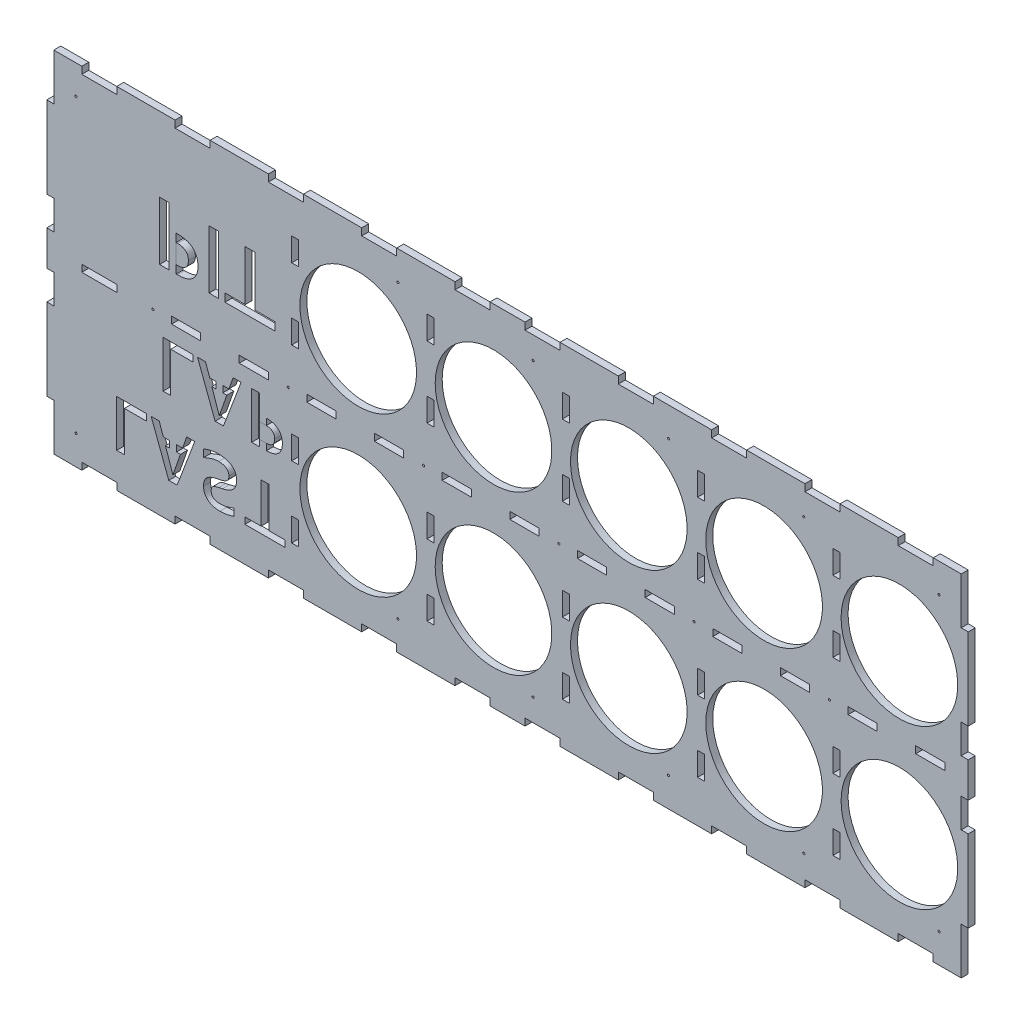
from build123d import *

# Parameters (mm, degrees)
SKETCH1_W           = 790
SKETCH1_H           = 300
BOSS_EXTRUDE1_DEPTH = 6
SKETCH2_R           = 50
SKETCH2_W           = 8.227848101
SKETCH2_H           = 50
CUT_EXTRUDE1_DEPTH  = 10
SKETCH3_W           = 6
SKETCH3_H           = 12.668314779
SKETCH3_H_2         = 22.429208267
SKETCH3_H_3         = 49.496892202
SKETCH3_H_4         = 32.552578478
BOSS_EXTRUDE2_DEPTH = 6
SKETCH4_W           = 6
SKETCH4_H           = 40
SKETCH4_H_2         = 25
SKETCH4_W_2         = 30
SKETCH4_H_3         = 6
CUT_EXTRUDE2_DEPTH  = 6
SKETCH5_W           = 6
SKETCH5_H           = 20
SKETCH5_W_2         = 25
SKETCH5_H_2         = 6
SKETCH5_W_3         = 30
CUT_EXTRUDE3_DEPTH  = 6
SKETCH6_R           = 0.9
CUT_EXTRUDE4_DEPTH  = 10


with BuildPart() as part:
    # Sketch1 → Boss-Extrude1 (new body)
    with BuildSketch(Plane.XY):
        Rectangle(SKETCH1_W, SKETCH1_H)
    extrude(amount=BOSS_EXTRUDE1_DEPTH)

    # Sketch2 → Cut-Extrude1 (cut)
    # profile 1 of 20: a face of its own
    with BuildSketch(Plane(origin=(0, 0, 0), x_dir=(-1, 0, 0), z_dir=(0, 0, -1))):
        with Locations((-336, -70)):
            Circle(SKETCH2_R)
    # profile 2 of 20: a face of its own
    with BuildSketch(Plane(origin=(0, 0, 0), x_dir=(-1, 0, 0), z_dir=(0, 0, -1))):
        with Locations((-220, -70)):
            Circle(SKETCH2_R)
    # profile 3 of 20: a face of its own
    with BuildSketch(Plane(origin=(0, 0, 0), x_dir=(-1, 0, 0), z_dir=(0, 0, -1))):
        with Locations((-220, 66)):
            Circle(SKETCH2_R)
    # profile 4 of 20: a face of its own
    with BuildSketch(Plane(origin=(0, 0, 0), x_dir=(-1, 0, 0), z_dir=(0, 0, -1))):
        with Locations((-336, 66)):
            Circle(SKETCH2_R)
    # profile 5 of 20: a face of its own
    with BuildSketch(Plane(origin=(0, 0, 0), x_dir=(-1, 0, 0), z_dir=(0, 0, -1))):
        with Locations((-104, -70)):
            Circle(SKETCH2_R)
    # profile 6 of 20: a face of its own
    with BuildSketch(Plane(origin=(0, 0, 0), x_dir=(-1, 0, 0), z_dir=(0, 0, -1))):
        with Locations((-104, 66)):
            Circle(SKETCH2_R)
    # profile 7 of 20: a face of its own
    with BuildSketch(Plane(origin=(0, 0, 0), x_dir=(-1, 0, 0), z_dir=(0, 0, -1))):
        with Locations((12, -70)):
            Circle(SKETCH2_R)
    # profile 8 of 20: a face of its own
    with BuildSketch(Plane(origin=(0, 0, 0), x_dir=(-1, 0, 0), z_dir=(0, 0, -1))):
        with Locations((12, 66)):
            Circle(SKETCH2_R)
    # profile 9 of 20: a face of its own
    with BuildSketch(Plane(origin=(0, 0, 0), x_dir=(-1, 0, 0), z_dir=(0, 0, -1))):
        with Locations((128, -70)):
            Circle(SKETCH2_R)
    # profile 10 of 20: a face of its own
    with BuildSketch(Plane(origin=(0, 0, 0), x_dir=(-1, 0, 0), z_dir=(0, 0, -1))):
        with Locations((128, 66)):
            Circle(SKETCH2_R)
    # profile 11 of 20: a face of its own
    with BuildSketch(Plane(origin=(0, 0, 0), x_dir=(-1, 0, 0), z_dir=(0, 0, -1))):
        Polygon((225.14556962, -120.218798151), (190.778481013, -120.218798151), (190.778481013, -114.649177898), (204.670886076, -114.649177898), (204.670886076, -80.218798151), (211.253164557, -80.218798151), (211.253164557, -114.649177898), (225.14556962, -114.649177898), align=None)
    # profile 12 of 20: a face of its own
    with BuildSketch(Plane(origin=(0, 0, 0), x_dir=(-1, 0, 0), z_dir=(0, 0, -1))):
        with BuildLine():
            Line((234.417721519, -118.952975366), (234.417721519, -112.971962708))
            add(Edge.make_bspline(
                [(234.417721519, -112.971962708), (235.081521479, -113.190583584), (236.340343747, -113.605173586), (238.137874243, -114.156998824), (239.734320913, -114.627998701), (241.159542182, -115.010208817), (242.471389001, -115.311664329), (243.728141686, -115.500857847), (244.949935558, -115.640852865), (245.754362835, -115.654914658), (246.150316456, -115.661836126)],
                knots=[0, 0, 0, 0, 1.387514266, 2.631265383, 3.733085333, 4.691935806, 5.560824757, 6.403543179, 7.214195147, 8, 8, 8, 8], degree=3))
            add(Edge.make_bspline(
                [(246.150316456, -115.661836126), (246.461695835, -115.6579689), (247.064219989, -115.650485755), (247.94032113, -115.573265886), (248.761822925, -115.472309692), (249.524023779, -115.300457608), (250.232028032, -115.098510987), (250.882662659, -114.847517322), (251.47460663, -114.542035129), (252.014125552, -114.197569058), (252.493419755, -113.799592872), (252.905650943, -113.35369311), (253.261896856, -112.865223712), (253.545419316, -112.322996421), (253.768014199, -111.733115497), (253.924621023, -111.095721916), (254.021249683, -110.411631251), (254.032291606, -109.939594818), (254.037974684, -109.696646252)],
                knots=[0, 0, 0, 0, 1.326535467, 2.56686767, 3.746182198, 4.850559987, 5.892565486, 6.88178199, 7.816648485, 8.726872872, 9.604603928, 10.463425553, 11.308684229, 12.173368185, 13.062535959, 13.989261226, 14.965109325, 16, 16, 16, 16], degree=3))
            add(Edge.make_bspline(
                [(254.037974684, -109.696646252), (254.032102073, -109.49088797), (254.020712168, -109.09182066), (253.970807997, -108.513865466), (253.865893234, -107.982280913), (253.726379485, -107.492267122), (253.534124724, -107.051889962), (253.312976856, -106.64678864), (253.042924792, -106.290582627), (252.726324164, -105.973678737), (252.347210321, -105.688533896), (251.895102966, -105.42632819), (251.369535125, -105.160283829), (250.761008706, -104.921987949), (250.07540711, -104.68921146), (249.309767057, -104.482642745), (248.466427515, -104.273254229), (247.875485876, -104.151263514), (247.566455696, -104.087469037)],
                knots=[0, 0, 0, 0, 1.028575137, 1.994917085, 2.894249351, 3.732318196, 4.53514972, 5.290280212, 6.033474337, 6.760249435, 7.52190509, 8.396472701, 9.36881544, 10.462595607, 11.65852342, 12.985296272, 14.423474718, 16, 16, 16, 16], degree=3))
            Line((247.566455696, -104.087469037), (244.433544304, -103.454557645))
            add(Edge.make_bspline(
                [(244.433544304, -103.454557645), (243.925816166, -103.346984679), (242.940982709, -103.138326842), (241.526290735, -102.737748059), (240.21371506, -102.292434646), (239.004836366, -101.785886862), (237.903556244, -101.22285903), (236.896666827, -100.616298177), (236.000207188, -99.940774226), (235.202088685, -99.211975189), (234.51047862, -98.419744872), (233.901741406, -97.578794847), (233.39739387, -96.674012484), (232.981959471, -95.714402726), (232.658522175, -94.702127347), (232.428205215, -93.631949556), (232.293943584, -92.505992897), (232.275326111, -91.735510258), (232.265822785, -91.342215872)],
                knots=[0, 0, 0, 0, 1.316920217, 2.554412477, 3.729152209, 4.833016039, 5.877706238, 6.866052438, 7.812465869, 8.721947532, 9.604074217, 10.47706315, 11.352102319, 12.227448608, 13.127049825, 14.044696133, 15.001911276, 16, 16, 16, 16], degree=3))
            add(Edge.make_bspline(
                [(232.265822785, -91.342215872), (232.276917789, -90.869406848), (232.298521213, -89.948785888), (232.49703091, -88.611447952), (232.795907487, -87.352295837), (233.247641259, -86.182290659), (233.807669404, -85.089270218), (234.502378176, -84.084510481), (235.326570026, -83.168196934), (236.272821955, -82.336315044), (237.335300613, -81.59118059), (238.516193937, -80.947045812), (239.81507679, -80.411036592), (241.22470572, -79.972673693), (242.744694951, -79.62137266), (244.380034668, -79.384115578), (246.128850245, -79.228943442), (247.334032507, -79.21388677), (247.954113924, -79.206139923)],
                knots=[0, 0, 0, 0, 1.007234792, 1.961217769, 2.876056137, 3.760332692, 4.627742002, 5.488477075, 6.356323441, 7.24844489, 8.16857014, 9.11698855, 10.10981412, 11.158773728, 12.260582194, 13.431628951, 14.678540823, 16, 16, 16, 16], degree=3))
            add(Edge.make_bspline(
                [(247.954113924, -79.206139923), (248.426377333, -79.214156725), (249.385516406, -79.230438375), (250.843708555, -79.35277366), (252.340201936, -79.560857773), (253.88086348, -79.850161301), (255.480716832, -80.211009804), (257.137248625, -80.686177914), (258.867286213, -81.233481279), (260.026229167, -81.67150258), (260.620253165, -81.896013341)],
                knots=[0, 0, 0, 0, 0.870421616, 1.767774863, 2.695117159, 3.65420996, 4.656488843, 5.716777356, 6.829718893, 8, 8, 8, 8], degree=3))
            Line((260.620253165, -81.896013341), (260.438291139, -88.264684227))
            add(Edge.make_bspline(
                [(260.438291139, -88.264684227), (259.761580895, -87.977436052), (258.471365844, -87.429768978), (256.61150583, -86.685124878), (254.912897375, -86.08544162), (253.360687871, -85.597556673), (251.902945606, -85.217564126), (250.478965968, -84.970558352), (249.073787643, -84.799754328), (248.13920631, -84.783697527), (247.67721519, -84.775760176)],
                knots=[0, 0, 0, 0, 1.323958492, 2.524257894, 3.607270171, 4.567153054, 5.454098878, 6.317697212, 7.16838811, 8, 8, 8, 8], degree=3))
            add(Edge.make_bspline(
                [(247.67721519, -84.775760176), (247.328983482, -84.779573155), (246.652647711, -84.786978724), (245.669252172, -84.865353391), (244.754058304, -85.003333944), (243.896411262, -85.169551284), (243.10772081, -85.411370613), (242.375190343, -85.689556958), (241.713954111, -86.036855744), (241.110692209, -86.419911351), (240.575786894, -86.857376711), (240.115548368, -87.342629547), (239.720829526, -87.869040758), (239.405220608, -88.446246622), (239.14723132, -89.06240559), (238.980029734, -89.726849459), (238.8600757, -90.428063875), (238.852164409, -90.911808467), (238.848101266, -91.160253847)],
                knots=[0, 0, 0, 0, 1.355236094, 2.632140116, 3.835515897, 4.956769147, 6.028392437, 7.042429441, 8.001907206, 8.930073714, 9.81981653, 10.683786847, 11.527521437, 12.372940068, 13.2383116, 14.119666881, 15.034283621, 16, 16, 16, 16], degree=3))
            add(Edge.make_bspline(
                [(238.848101266, -91.160253847), (238.8513918, -91.376858387), (238.857835865, -91.801048892), (238.945090852, -92.41590758), (239.052675357, -93.000671556), (239.245088289, -93.538759019), (239.459841429, -94.050691651), (239.740610951, -94.518751535), (240.069029975, -94.94906286), (240.443502268, -95.352279702), (240.889246542, -95.717145053), (241.393809026, -96.067500283), (241.980824177, -96.382708676), (242.6338198, -96.676161546), (243.34975085, -96.970128523), (244.144523194, -97.213810492), (245.005571271, -97.455901249), (245.608911498, -97.587473672), (245.920886076, -97.655507012)],
                knots=[0, 0, 0, 0, 0.97844014, 1.916141821, 2.804796213, 3.660769132, 4.49375928, 5.311764199, 6.120240336, 6.938505946, 7.793481616, 8.71958745, 9.712166798, 10.80067234, 11.956522289, 13.20850853, 14.556578305, 16, 16, 16, 16], degree=3))
            Line((245.920886076, -97.655507012), (249.125, -98.288418404))
            add(Edge.make_bspline(
                [(249.125, -98.288418404), (249.608882572, -98.388389364), (250.550869909, -98.583005545), (251.898803607, -98.95701386), (253.147185942, -99.369958994), (254.299768004, -99.813573295), (255.343642252, -100.323183279), (256.292340346, -100.866260489), (257.135791822, -101.46095813), (257.880997713, -102.105228273), (258.527512021, -102.811173043), (259.095141933, -103.570195829), (259.563124357, -104.405343202), (259.951772604, -105.300752177), (260.252853259, -106.263706956), (260.461978803, -107.292381214), (260.603451813, -108.384705511), (260.614561249, -109.137104384), (260.620253165, -109.522595619)],
                knots=[0, 0, 0, 0, 1.332781836, 2.594562577, 3.771290481, 4.879812294, 5.923558003, 6.902274905, 7.826154199, 8.703636118, 9.554612488, 10.404159945, 11.254898329, 12.131225666, 13.033594531, 13.971315179, 14.960604212, 16, 16, 16, 16], degree=3))
            add(Edge.make_bspline(
                [(260.620253165, -109.522595619), (260.611809821, -109.966371661), (260.595348978, -110.831541734), (260.403089062, -112.092080741), (260.115053832, -113.280426331), (259.711925305, -114.401629915), (259.176289863, -115.443611443), (258.52561769, -116.412844524), (257.755213496, -117.307053698), (256.878837385, -118.128519385), (255.898933626, -118.861916285), (254.829137032, -119.498136778), (253.677510931, -120.039056683), (252.43536542, -120.471641813), (251.111704286, -120.810625986), (249.704393151, -121.053153139), (248.216021252, -121.207985007), (247.195016899, -121.22351047), (246.672468354, -121.231456379)],
                knots=[0, 0, 0, 0, 1.034391986, 2.016614024, 2.967035657, 3.88364751, 4.788813341, 5.693100755, 6.600563169, 7.536297846, 8.489820244, 9.449888662, 10.435111384, 11.452683468, 12.513536151, 13.618971183, 14.781392911, 16, 16, 16, 16], degree=3))
            add(Edge.make_bspline(
                [(246.672468354, -121.231456379), (246.202844357, -121.226106377), (245.254572066, -121.215303569), (243.827317671, -121.103028109), (242.379950191, -120.94973222), (240.906821419, -120.71679035), (239.38615414, -120.406041911), (237.798715948, -120.00478156), (236.130173241, -119.52449572), (234.999206291, -119.147042374), (234.417721519, -118.952975366)],
                knots=[0, 0, 0, 0, 0.899764631, 1.816819142, 2.742107722, 3.68843727, 4.673587613, 5.715410157, 6.82538194, 8, 8, 8, 8], degree=3))
        make_face()
    # profile 13 of 20: a face of its own
    with BuildSketch(Plane(origin=(0, 0, 0), x_dir=(-1, 0, 0), z_dir=(0, 0, -1))):
        Polygon((290.422468354, -120.218798151), (283.294303797, -120.218798151), (268.143987342, -80.218798151), (275.026898734, -80.218798151), (278.594936709, -90.345380429), (295.058544304, -90.345380429), (298.626582278, -80.218798151), (305.517405063, -80.218798151), align=None)
        Polygon((286.85443038, -114.396013341), (293.254746835, -95.915000683), (280.414556962, -95.915000683), align=None, mode=Mode.SUBTRACT)
    # profile 14 of 20: a face of its own
    with BuildSketch(Plane(origin=(0, 0, 0), x_dir=(-1, 0, 0), z_dir=(0, 0, -1))):
        Polygon((335.050632911, -120.218798151), (328.46835443, -120.218798151), (328.46835443, -85.788418404), (309.393987342, -85.788418404), (309.393987342, -80.218798151), (335.050632911, -80.218798151), align=None)
    # profile 15 of 20: a face of its own
    with BuildSketch(Plane(origin=(0, 0, 0), x_dir=(-1, 0, 0), z_dir=(0, 0, -1))):
        with BuildLine():
            Line((219.35443038, -56.421329796), (207.115506329, -56.421329796))
            add(Edge.make_bspline(
                [(207.115506329, -56.421329796), (206.550781715, -56.41354521), (205.453482986, -56.398419224), (203.862414328, -56.24386862), (202.374879406, -56.003995204), (200.994191689, -55.658753791), (199.722756615, -55.207433905), (198.560089958, -54.661700014), (197.503989801, -54.017608021), (196.560706656, -53.271379136), (195.723116422, -52.436037454), (194.997476214, -51.51170493), (194.389392091, -50.50242951), (193.884870623, -49.415909793), (193.49776419, -48.244872965), (193.224505682, -46.990711948), (193.054935044, -45.655921745), (193.03535519, -44.739359311), (193.025316456, -44.269431062)],
                knots=[0, 0, 0, 0, 1.277438102, 2.482150011, 3.613205912, 4.684143857, 5.697637066, 6.661209294, 7.585322811, 8.490202945, 9.376256063, 10.255997937, 11.142211775, 12.036564167, 12.961159168, 13.926798438, 14.937054428, 16, 16, 16, 16], degree=3))
            add(Edge.make_bspline(
                [(193.025316456, -44.269431062), (193.035242784, -43.796845947), (193.054550774, -42.877606908), (193.224347662, -41.542952452), (193.496163049, -40.289729701), (193.897061004, -39.122951124), (194.392600357, -38.031508356), (195.007479361, -37.02344956), (195.739408856, -36.105469734), (196.576746582, -35.264623772), (197.52839319, -34.521565856), (198.59183589, -33.877020692), (199.762513306, -33.331478117), (201.041771995, -32.880129002), (202.430335068, -32.534898348), (203.925742489, -32.295021405), (205.527329564, -32.140200196), (206.632531597, -32.12524524), (207.202531646, -32.117532328)],
                knots=[0, 0, 0, 0, 1.065153118, 2.071860278, 3.02830301, 3.951547624, 4.848157081, 5.726178742, 6.606512709, 7.489453297, 8.395828193, 9.321768641, 10.287335273, 11.30287145, 12.37581297, 13.508762086, 14.715161852, 16, 16, 16, 16], degree=3))
            Line((207.202531646, -32.117532328), (212.772151899, -32.117532328))
            Line((212.772151899, -32.117532328), (212.772151899, -16.421329796))
            Line((212.772151899, -16.421329796), (219.35443038, -16.421329796))
            Line((219.35443038, -16.421329796), (219.35443038, -56.421329796))
        make_face()
        with BuildLine():
            Line((212.772151899, -50.851709543), (212.772151899, -37.687152581))
            Line((212.772151899, -37.687152581), (207.004746835, -37.687152581))
            add(Edge.make_bspline(
                [(207.004746835, -37.687152581), (206.714468816, -37.690876161), (206.148582825, -37.698135139), (205.326140663, -37.77839103), (204.55545597, -37.909758489), (203.839694117, -38.102981656), (203.172101028, -38.33601266), (202.558920657, -38.630065504), (202.000569904, -38.979239264), (201.500213847, -39.384962948), (201.057196399, -39.838318871), (200.663031628, -40.329962488), (200.339204629, -40.875196593), (200.066719412, -41.462431524), (199.864213148, -42.101375456), (199.71211777, -42.783956692), (199.627124057, -43.513079616), (199.614205123, -44.013422402), (199.607594937, -44.269431062)],
                knots=[0, 0, 0, 0, 1.234500831, 2.406612556, 3.511399, 4.55635263, 5.557008239, 6.515391404, 7.442943421, 8.352270097, 9.248702812, 10.13525329, 11.026052437, 11.939659621, 12.883353545, 13.871415421, 14.9108745, 16, 16, 16, 16], degree=3))
            add(Edge.make_bspline(
                [(199.607594937, -44.269431062), (199.614059295, -44.525458997), (199.626627112, -45.023221085), (199.712981954, -45.749490764), (199.86395362, -46.429709196), (200.067435695, -47.068071022), (200.337271624, -47.658600867), (200.6747377, -48.19927068), (201.061890203, -48.700304278), (201.5094488, -49.155615985), (202.013028704, -49.558924463), (202.579056209, -49.898241232), (203.183389997, -50.203671885), (203.850180747, -50.435909671), (204.562404325, -50.632276801), (205.332962377, -50.746416177), (206.150478596, -50.844770926), (206.714311613, -50.849350543), (207.004746835, -50.851709543)],
                knots=[0, 0, 0, 0, 1.089888154, 2.118928947, 3.107682707, 4.052037448, 4.96628438, 5.863555534, 6.75956164, 7.656622077, 8.575338335, 9.497614461, 10.461584131, 11.452375249, 12.498060601, 13.601738083, 14.764634717, 16, 16, 16, 16], degree=3))
            Line((207.004746835, -50.851709543), (212.772151899, -50.851709543))
        make_face(mode=Mode.SUBTRACT)
    # profile 16 of 20: a face of its own
    with BuildSketch(Plane(origin=(0, 0, 0), x_dir=(-1, 0, 0), z_dir=(0, 0, -1))):
        Polygon((250.675632911, -56.421329796), (243.547468354, -56.421329796), (228.397151899, -16.421329796), (235.280063291, -16.421329796), (238.848101266, -26.547912075), (255.311708861, -26.547912075), (258.879746835, -16.421329796), (265.77056962, -16.421329796), align=None)
        Polygon((247.107594937, -50.598544986), (253.507911392, -32.117532328), (240.667721519, -32.117532328), align=None, mode=Mode.SUBTRACT)
    # profile 17 of 20: a face of its own
    with BuildSketch(Plane(origin=(0, 0, 0), x_dir=(-1, 0, 0), z_dir=(0, 0, -1))):
        Polygon((295.303797468, -56.421329796), (288.721518987, -56.421329796), (288.721518987, -21.99095005), (269.647151899, -21.99095005), (269.647151899, -16.421329796), (295.303797468, -16.421329796), align=None)
    # profile 18 of 20: a face of its own
    with BuildSketch(Plane(origin=(0, 0, 0), x_dir=(-1, 0, 0), z_dir=(0, 0, -1))):
        with BuildLine():
            Line((298.275758659, 36.137930577), (282.977103596, 36.137930577))
            add(Edge.make_bspline(
                [(282.977103596, 36.137930577), (282.271197829, 36.14766131), (280.899574418, 36.166568793), (278.910738595, 36.359757047), (277.051319943, 36.659598818), (275.325460296, 37.091150584), (273.736166453, 37.655300442), (272.282833133, 38.337467806), (270.962707936, 39.142582796), (269.783604005, 40.075368903), (268.736616213, 41.119546004), (267.829565952, 42.27496166), (267.069460799, 43.536555935), (266.438808964, 44.894705582), (265.954925922, 46.358501616), (265.613352787, 47.926202887), (265.40138949, 49.594690641), (265.376914672, 50.740393683), (265.364366254, 51.327803995)],
                knots=[0, 0, 0, 0, 1.277438102, 2.482150011, 3.613205912, 4.684143857, 5.697637066, 6.661209294, 7.585322811, 8.490202945, 9.376256063, 10.255997937, 11.142211775, 12.036564167, 12.961159168, 13.926798438, 14.937054428, 16, 16, 16, 16], degree=3))
            add(Edge.make_bspline(
                [(265.364366254, 51.327803995), (265.376774165, 51.918535389), (265.400909152, 53.067584187), (265.613155262, 54.735902257), (265.952924496, 56.302430696), (266.45404694, 57.760903918), (267.073471131, 59.125207377), (267.842069886, 60.385280872), (268.756981755, 61.532755655), (269.803653913, 62.583813108), (270.993212173, 63.512635503), (272.322515547, 64.318316957), (273.785862318, 65.000245177), (275.384935678, 65.56443157), (277.120639519, 65.995969888), (278.989898796, 66.295816066), (280.991882639, 66.489342578), (282.37338518, 66.508036273), (283.085885242, 66.517677412)],
                knots=[0, 0, 0, 0, 1.065153118, 2.071860278, 3.02830301, 3.951547624, 4.848157081, 5.726178742, 6.606512709, 7.489453297, 8.395828193, 9.321768641, 10.287335273, 11.30287145, 12.37581297, 13.508762086, 14.715161852, 16, 16, 16, 16], degree=3))
            Line((283.085885242, 66.517677412), (290.047910558, 66.517677412))
            Line((290.047910558, 66.517677412), (290.047910558, 86.137930577))
            Line((290.047910558, 86.137930577), (298.275758659, 86.137930577))
            Line((298.275758659, 86.137930577), (298.275758659, 36.137930577))
        make_face()
        with BuildLine():
            Line((290.047910558, 43.099955893), (290.047910558, 59.555652096))
            Line((290.047910558, 59.555652096), (282.838654229, 59.555652096))
            add(Edge.make_bspline(
                [(282.838654229, 59.555652096), (282.475806705, 59.550997621), (281.768449216, 59.541923898), (280.740396513, 59.441604034), (279.777040648, 59.277394712), (278.882338331, 59.035865753), (278.047846969, 58.744576997), (277.281371506, 58.377010942), (276.583433065, 57.940543742), (275.957987993, 57.433389138), (275.404216184, 56.866694234), (274.91151022, 56.252139713), (274.506726471, 55.570597081), (274.16611995, 54.836553417), (273.91298712, 54.037873502), (273.722867898, 53.184646957), (273.616625756, 52.273243302), (273.600477089, 51.64781482), (273.592214356, 51.327803995)],
                knots=[0, 0, 0, 0, 1.234500831, 2.406612556, 3.511399, 4.55635263, 5.557008239, 6.515391404, 7.442943421, 8.352270097, 9.248702812, 10.13525329, 11.026052437, 11.939659621, 12.883353545, 13.871415421, 14.9108745, 16, 16, 16, 16], degree=3))
            add(Edge.make_bspline(
                [(273.592214356, 51.327803995), (273.600294803, 51.007769076), (273.616004575, 50.385566466), (273.723948127, 49.477729368), (273.91266271, 48.627456327), (274.167015303, 47.829504044), (274.504310215, 47.091341739), (274.92614281, 46.415504472), (275.410083439, 45.789212474), (275.969531684, 45.220072842), (276.599006565, 44.715937244), (277.306540946, 44.291791282), (278.061958181, 43.910002967), (278.895446618, 43.619705734), (279.78572609, 43.374246821), (280.748923656, 43.231572602), (281.770818929, 43.108629165), (282.4756102, 43.102904644), (282.838654229, 43.099955893)],
                knots=[0, 0, 0, 0, 1.089888154, 2.118928947, 3.107682707, 4.052037448, 4.96628438, 5.863555534, 6.75956164, 7.656622077, 8.575338335, 9.497614461, 10.461584131, 11.452375249, 12.498060601, 13.601738083, 14.764634717, 16, 16, 16, 16], degree=3))
            Line((282.838654229, 43.099955893), (290.047910558, 43.099955893))
        make_face(mode=Mode.SUBTRACT)
    # profile 19 of 20: a face of its own
    with BuildSketch(Plane(origin=(0, 0, 0), x_dir=(-1, 0, 0), z_dir=(0, 0, -1))):
        with Locations((251.756771318, 61.137930577)):
            Rectangle(SKETCH2_W, SKETCH2_H)
    # profile 20 of 20: a face of its own
    with BuildSketch(Plane(origin=(0, 0, 0), x_dir=(-1, 0, 0), z_dir=(0, 0, -1))):
        Polygon((242.22354347, 36.137930577), (199.26468271, 36.137930577), (199.26468271, 43.099955893), (216.630189039, 43.099955893), (216.630189039, 86.137930577), (224.858037141, 86.137930577), (224.858037141, 43.099955893), (242.22354347, 43.099955893), align=None)
    extrude(amount=-CUT_EXTRUDE1_DEPTH, mode=Mode.SUBTRACT)


with BuildPart() as cut_extrude1_piece_1:
    # of the separate pieces the step leaves, piece 1, a body of its own (cut_extrude1_pieces)
    add(part.part.solids().sort_by_distance((395, 150, 0))[0])



with BuildPart() as cut_extrude1_piece_2:
    # of the separate pieces the step leaves, piece 2, a body of its own (cut_extrude1_pieces)
    add(part.part.solids().sort_by_distance((-290.047910558, 43.099955893, 0))[0])


with BuildPart() as cut_extrude1_piece_3:
    # of the separate pieces the step leaves, piece 3, a body of its own (cut_extrude1_pieces)
    add(part.part.solids().sort_by_distance((-212.772151899, -50.851709543, 0))[0])


with BuildPart() as cut_extrude1_piece_4:
    # of the separate pieces the step leaves, piece 4, a body of its own (cut_extrude1_pieces)
    add(part.part.solids().sort_by_distance((-286.85443038, -114.396013341, 0))[0])


with BuildPart() as cut_extrude1_piece_5:
    # of the separate pieces the step leaves, piece 5, a body of its own (cut_extrude1_pieces)
    add(part.part.solids().sort_by_distance((-247.107594937, -50.598544986, 0))[0])


with BuildPart() as cut_extrude1_piece_1_1:
    add(cut_extrude1_piece_1.part)

    add(cut_extrude1_piece_4.part)  # Boss-Extrude2 merges Cut-Extrude1 piece 4

    add(cut_extrude1_piece_5.part)  # Boss-Extrude2 merges Cut-Extrude1 piece 5
    # Sketch3 → Boss-Extrude2 (add)
    with BuildSketch(Plane(origin=(0, 0, 0), x_dir=(-1, 0, 0), z_dir=(0, 0, -1))):
        with Locations((286.858386076, -93.696525154)):
            Rectangle(SKETCH3_W, SKETCH3_H)
        with Locations((247.111550633, -25.112303189)):
            Rectangle(SKETCH3_W, SKETCH3_H_2)
        with Locations((287.047910558, 56.796967493)):
            Rectangle(SKETCH3_W, SKETCH3_H_3)
        with Locations((209.772151899, -43.534195964)):
            Rectangle(SKETCH3_W, SKETCH3_H_4)
    extrude(amount=-BOSS_EXTRUDE2_DEPTH)

    # Sketch4 → Cut-Extrude2 (cut)
    with BuildSketch(Plane(origin=(0, 0, 0), x_dir=(-1, 0, 0), z_dir=(0, 0, -1))):
        with Locations((-392, -130)):
            Rectangle(SKETCH4_W, SKETCH4_H)
        with Locations((-392, -27.5)):
            Rectangle(SKETCH4_W, SKETCH4_H_2)
        with Locations((-30, 147)):
            Rectangle(SKETCH4_W_2, SKETCH4_H_3)
        with Locations((-392, 27.5)):
            Rectangle(SKETCH4_W, SKETCH4_H_2)
        with Locations((-392, 130)):
            Rectangle(SKETCH4_W, SKETCH4_H)
        with Locations((392, 130)):
            Rectangle(SKETCH4_W, SKETCH4_H)
        with Locations((392, 27.5)):
            Rectangle(SKETCH4_W, SKETCH4_H_2)
        with Locations((392, -27.5)):
            Rectangle(SKETCH4_W, SKETCH4_H_2)
        with Locations((392, -130)):
            Rectangle(SKETCH4_W, SKETCH4_H)
        with Locations((-110, 147)):
            Rectangle(SKETCH4_W_2, SKETCH4_H_3)
        with Locations((-190, 147)):
            Rectangle(SKETCH4_W_2, SKETCH4_H_3)
        with Locations((-270, 147)):
            Rectangle(SKETCH4_W_2, SKETCH4_H_3)
        with Locations((-350, 147)):
            Rectangle(SKETCH4_W_2, SKETCH4_H_3)
        with Locations((350, 147)):
            Rectangle(SKETCH4_W_2, SKETCH4_H_3)
        with Locations((270, 147)):
            Rectangle(SKETCH4_W_2, SKETCH4_H_3)
        with Locations((190, 147)):
            Rectangle(SKETCH4_W_2, SKETCH4_H_3)
        with Locations((110, 147)):
            Rectangle(SKETCH4_W_2, SKETCH4_H_3)
        with Locations((30, 147)):
            Rectangle(SKETCH4_W_2, SKETCH4_H_3)
        with Locations((30, -147)):
            Rectangle(SKETCH4_W_2, SKETCH4_H_3)
        with Locations((110, -147)):
            Rectangle(SKETCH4_W_2, SKETCH4_H_3)
        with Locations((190, -147)):
            Rectangle(SKETCH4_W_2, SKETCH4_H_3)
        with Locations((270, -147)):
            Rectangle(SKETCH4_W_2, SKETCH4_H_3)
        with Locations((350, -147)):
            Rectangle(SKETCH4_W_2, SKETCH4_H_3)
        with Locations((-350, -147)):
            Rectangle(SKETCH4_W_2, SKETCH4_H_3)
        with Locations((-270, -147)):
            Rectangle(SKETCH4_W_2, SKETCH4_H_3)
        with Locations((-190, -147)):
            Rectangle(SKETCH4_W_2, SKETCH4_H_3)
        with Locations((-110, -147)):
            Rectangle(SKETCH4_W_2, SKETCH4_H_3)
        with Locations((-30, -147)):
            Rectangle(SKETCH4_W_2, SKETCH4_H_3)
    extrude(amount=-CUT_EXTRUDE2_DEPTH, mode=Mode.SUBTRACT)

    # Sketch5 → Cut-Extrude3 (cut)
    with BuildSketch(Plane(origin=(0, 0, 0), x_dir=(-1, 0, 0), z_dir=(0, 0, -1))):
        with Locations((-282, 104)):
            Rectangle(SKETCH5_W, SKETCH5_H)
        with Locations((-282, 43)):
            Rectangle(SKETCH5_W, SKETCH5_H)
        with Locations((-282, -43)):
            Rectangle(SKETCH5_W, SKETCH5_H)
        with Locations((-282, -104)):
            Rectangle(SKETCH5_W, SKETCH5_H)
        with Locations((-362.5, 0)):
            Rectangle(SKETCH5_W_2, SKETCH5_H_2)
        with Locations((350, 0)):
            Rectangle(SKETCH5_W_3, SKETCH5_H_2)
        with Locations((-166, 104)):
            Rectangle(SKETCH5_W, SKETCH5_H)
        with Locations((-166, 43)):
            Rectangle(SKETCH5_W, SKETCH5_H)
        with Locations((-166, -43)):
            Rectangle(SKETCH5_W, SKETCH5_H)
        with Locations((-166, -104)):
            Rectangle(SKETCH5_W, SKETCH5_H)
        with Locations((-50, 104)):
            Rectangle(SKETCH5_W, SKETCH5_H)
        with Locations((-50, 43)):
            Rectangle(SKETCH5_W, SKETCH5_H)
        with Locations((-50, -43)):
            Rectangle(SKETCH5_W, SKETCH5_H)
        with Locations((-50, -104)):
            Rectangle(SKETCH5_W, SKETCH5_H)
        with Locations((66, 104)):
            Rectangle(SKETCH5_W, SKETCH5_H)
        with Locations((66, 43)):
            Rectangle(SKETCH5_W, SKETCH5_H)
        with Locations((66, -43)):
            Rectangle(SKETCH5_W, SKETCH5_H)
        with Locations((66, -104)):
            Rectangle(SKETCH5_W, SKETCH5_H)
        with Locations((182, 104)):
            Rectangle(SKETCH5_W, SKETCH5_H)
        with Locations((182, 43)):
            Rectangle(SKETCH5_W, SKETCH5_H)
        with Locations((182, -43)):
            Rectangle(SKETCH5_W, SKETCH5_H)
        with Locations((182, -104)):
            Rectangle(SKETCH5_W, SKETCH5_H)
        with Locations((-304.5, 0)):
            Rectangle(SKETCH5_W_2, SKETCH5_H_2)
        with Locations((-246.5, 0)):
            Rectangle(SKETCH5_W_2, SKETCH5_H_2)
        with Locations((-188.5, 0)):
            Rectangle(SKETCH5_W_2, SKETCH5_H_2)
        with Locations((-130.5, 0)):
            Rectangle(SKETCH5_W_2, SKETCH5_H_2)
        with Locations((-72.5, 0)):
            Rectangle(SKETCH5_W_2, SKETCH5_H_2)
        with Locations((-14.5, 0)):
            Rectangle(SKETCH5_W_2, SKETCH5_H_2)
        with Locations((43.5, 0)):
            Rectangle(SKETCH5_W_2, SKETCH5_H_2)
        with Locations((101.5, 0)):
            Rectangle(SKETCH5_W_2, SKETCH5_H_2)
        with Locations((159.5, 0)):
            Rectangle(SKETCH5_W_2, SKETCH5_H_2)
        with Locations((217.5, 0)):
            Rectangle(SKETCH5_W_2, SKETCH5_H_2)
        with Locations((275.5, 0)):
            Rectangle(SKETCH5_W_2, SKETCH5_H_2)
    extrude(amount=-CUT_EXTRUDE3_DEPTH, mode=Mode.SUBTRACT)

    # Sketch6 → Cut-Extrude4 (cut)
    with BuildSketch(Plane(origin=(0, 0, 0), x_dir=(-1, 0, 0), z_dir=(0, 0, -1))):
        with Locations((-370, -125)):
            Circle(SKETCH6_R)
        with Locations((-370, 125)):
            Circle(SKETCH6_R)
        with Locations((-254, -125)):
            Circle(SKETCH6_R)
        with Locations((-254, 125)):
            Circle(SKETCH6_R)
        with Locations((-138, -125)):
            Circle(SKETCH6_R)
        with Locations((-138, 125)):
            Circle(SKETCH6_R)
        with Locations((-22, -125)):
            Circle(SKETCH6_R)
        with Locations((-22, 125)):
            Circle(SKETCH6_R)
        with Locations((94, -125)):
            Circle(SKETCH6_R)
        with Locations((94, 125)):
            Circle(SKETCH6_R)
        with Locations((370, 125)):
            Circle(SKETCH6_R)
        with Locations((370, -125)):
            Circle(SKETCH6_R)
        with Locations((-276, 0)):
            Circle(SKETCH6_R)
        with Locations((-160, 0)):
            Circle(SKETCH6_R)
        with Locations((-44, 0)):
            Circle(SKETCH6_R)
        with Locations((72, 0)):
            Circle(SKETCH6_R)
        with Locations((188, 0)):
            Circle(SKETCH6_R)
        with Locations((304, 0)):
            Circle(SKETCH6_R)
    extrude(amount=-CUT_EXTRUDE4_DEPTH, mode=Mode.SUBTRACT)


solid = Compound([cut_extrude1_piece_2.part, cut_extrude1_piece_3.part, cut_extrude1_piece_1_1.part])
